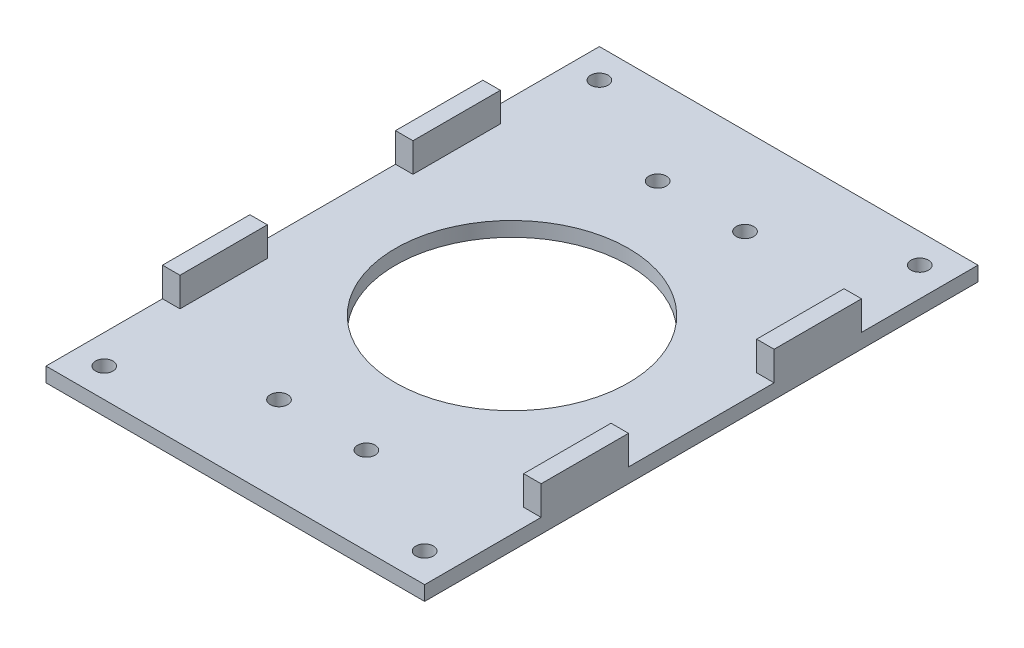
from build123d import *

# Parameters (mm, degrees)
CROQUIS1_W              = 65
CROQUIS1_H              = 95
SALIENTE_EXTRUIR1_DEPTH = 2.5
CROQUIS2_W              = 3
CROQUIS2_H              = 15
SALIENTE_EXTRUIR2_DEPTH = 5
CROQUIS3_R              = 1.5
CORTAR_EXTRUIR2_DEPTH   = 58.771100041
CROQUIS4_R              = 20
CORTAR_EXTRUIR3_DEPTH   = 58.771100041


with BuildPart() as part:
    # Croquis1 → Saliente-Extruir1 (new body)
    with BuildSketch(Plane(origin=(0, 0, 0), x_dir=(1, 0, 0), z_dir=(0, 1, 0))):
        Rectangle(CROQUIS1_W, CROQUIS1_H)
    extrude(amount=SALIENTE_EXTRUIR1_DEPTH)

    # Croquis2 → Saliente-Extruir2 (add)
    with BuildSketch(Plane(origin=(0, 2.5, 0), x_dir=(1, 0, 0), z_dir=(0, 1, 0))):
        with Locations((-31, 20)):
            Rectangle(CROQUIS2_W, CROQUIS2_H)
        with Locations((-31, -20)):
            Rectangle(CROQUIS2_W, CROQUIS2_H)
        with Locations((31, 20)):
            Rectangle(CROQUIS2_W, CROQUIS2_H)
        with Locations((31, -20)):
            Rectangle(CROQUIS2_W, CROQUIS2_H)
    extrude(amount=SALIENTE_EXTRUIR2_DEPTH)

    # Croquis3 → Cortar-Extruir2 (cut, through all)
    with BuildSketch(Plane(origin=(0, 2.5, 0), x_dir=(1, 0, 0), z_dir=(0, 1, 0))):
        with Locations((27.5, 42.5)):
            Circle(CROQUIS3_R)
        with Locations((7.5, 32.5)):
            Circle(CROQUIS3_R)
        with Locations((7.5, -32.5)):
            Circle(CROQUIS3_R)
        with Locations((27.5, -42.5)):
            Circle(CROQUIS3_R)
        with Locations((-27.5, 42.5)):
            Circle(CROQUIS3_R)
        with Locations((-7.5, 32.5)):
            Circle(CROQUIS3_R)
        with Locations((-27.5, -42.5)):
            Circle(CROQUIS3_R)
        with Locations((-7.5, -32.5)):
            Circle(CROQUIS3_R)
    extrude(amount=-CORTAR_EXTRUIR2_DEPTH, mode=Mode.SUBTRACT)

    # Croquis4 → Cortar-Extruir3 (cut, through all)
    with BuildSketch(Plane(origin=(0, 2.5, 0), x_dir=(1, 0, 0), z_dir=(0, 1, 0))):
        Circle(CROQUIS4_R)
    extrude(amount=-CORTAR_EXTRUIR3_DEPTH, mode=Mode.SUBTRACT)


solid = part.part
